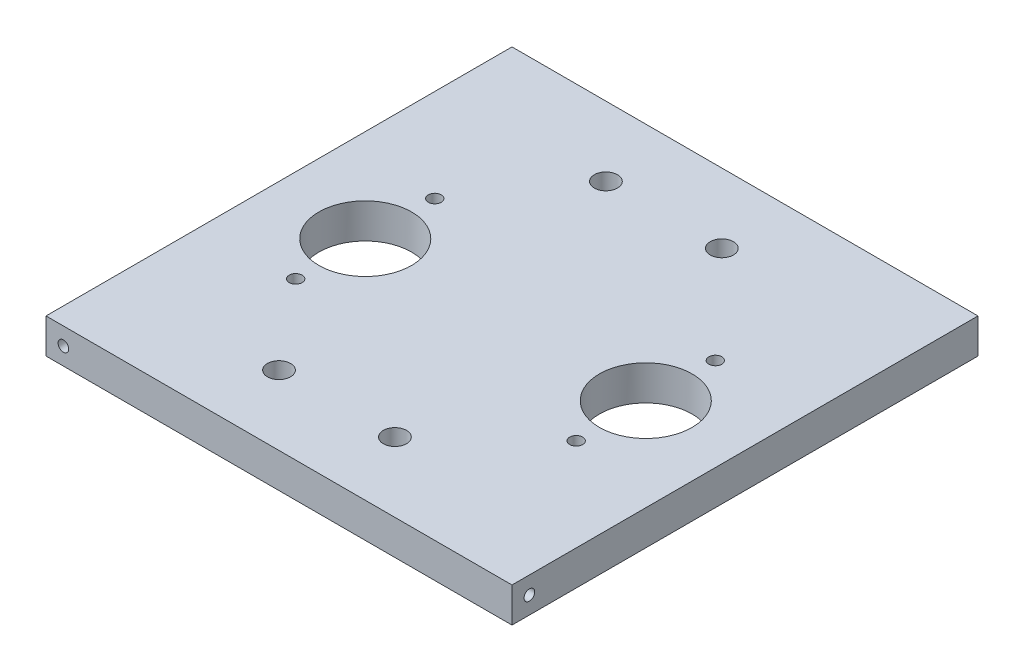
from build123d import *

# Parameters (mm, degrees)
SKETCH1_W                      = 127.635
SKETCH1_H                      = 127.635
MAIN_PLATE_DEPTH               = 9.525
SKETCH2_R                      = 3.175
U_BOLT_HOLE_DEPTH              = 12.7
U_BOLT_PATTERN_COUNT           = 2
U_BOLT_PATTERN_PITCH           = 31.75
U_BOLT_PATTERN_COUNT_DIR2      = 2
U_BOLT_PATTERN_PITCH_DIR2      = 89.535
SKETCH3_R                      = 1.778
RAPTOR_BOLT_HOLE_DEPTH         = 12.7
RAPTOR_BOLT_PATTERN_COUNT      = 2
RAPTOR_BOLT_PATTERN_PITCH      = 38.1
RAPTOR_BOLT_PATTERN_COUNT_DIR2 = 2
RAPTOR_BOLT_PATTERN_PITCH_DIR2 = 76.835
SKETCH4_R                      = 12.7
CO2_CYLINDER_HOLE_DEPTH        = 12.7
CO2_PATTERN_COUNT              = 2
CO2_PATTERN_PITCH              = 76.835
SKETCH5_R                      = 1.4605
FRAME_ATTACHMENT_HOLE_1_DEPTH  = 12.7
SKETCH6_R                      = 1.4605
FRAME_ATTACHMENT_HOLE_2_DEPTH  = 12.7
SKETCH7_R                      = 1.4605
FRAME_ATTACHMENT_HOLE_3_DEPTH  = 12.7
SKETCH8_R                      = 1.4605
FRAME_ATTACHMENT_HOLE_4_DEPTH  = 12.7


with BuildPart() as part:
    # Sketch1 → Main Plate (new body)
    with BuildSketch(Plane(origin=(0, 0, 0), x_dir=(1, 0, 0), z_dir=(0, 1, 0))):
        with Locations((63.8175, 63.8175)):
            Rectangle(SKETCH1_W, SKETCH1_H)
    extrude(amount=MAIN_PLATE_DEPTH)

    # Sketch2 → U-Bolt Hole (cut)
    with BuildSketch(Plane(origin=(0, 9.525, 0), x_dir=(1, 0, 0), z_dir=(0, 1, 0))):
        with Locations((44.7675, 108.585)):
            Circle(SKETCH2_R)
    u_bolt_hole = extrude(amount=-U_BOLT_HOLE_DEPTH, mode=Mode.SUBTRACT)

    # U-Bolt Pattern: U-Bolt Hole 2 × 2
    with Locations(*[(i * U_BOLT_PATTERN_PITCH, 0, j * U_BOLT_PATTERN_PITCH_DIR2) for i in range(U_BOLT_PATTERN_COUNT) for j in range(U_BOLT_PATTERN_COUNT_DIR2) if (i, j) != (0, 0)]):
        add(u_bolt_hole, mode=Mode.SUBTRACT)

    # Sketch3 → Raptor Bolt Hole (cut)
    with BuildSketch(Plane(origin=(0, 9.525, 0), x_dir=(1, 0, 0), z_dir=(0, 1, 0))):
        with Locations((25.4, 42.9895)):
            Circle(SKETCH3_R)
    raptor_bolt_hole = extrude(amount=-RAPTOR_BOLT_HOLE_DEPTH, mode=Mode.SUBTRACT)

    # Raptor Bolt Pattern: Raptor Bolt Hole 2 × 2
    with Locations(*[(j * RAPTOR_BOLT_PATTERN_PITCH_DIR2, 0, -i * RAPTOR_BOLT_PATTERN_PITCH) for i in range(RAPTOR_BOLT_PATTERN_COUNT) for j in range(RAPTOR_BOLT_PATTERN_COUNT_DIR2) if (i, j) != (0, 0)]):
        add(raptor_bolt_hole, mode=Mode.SUBTRACT)

    # Sketch4 → Co2 Cylinder Hole (cut)
    with BuildSketch(Plane(origin=(0, 9.525, 0), x_dir=(1, 0, 0), z_dir=(0, 1, 0))):
        with Locations((25.4, 62.0395)):
            Circle(SKETCH4_R)
    co2_cylinder_hole = extrude(amount=-CO2_CYLINDER_HOLE_DEPTH, mode=Mode.SUBTRACT)

    # Co2 Pattern: Co2 Cylinder Hole ×2
    with Locations(*[(i * CO2_PATTERN_PITCH, 0, 0) for i in range(1, CO2_PATTERN_COUNT)]):
        add(co2_cylinder_hole, mode=Mode.SUBTRACT)

    # Sketch5 → Frame attachment hole 1 (cut)
    with BuildSketch(Plane.XY):
        with Locations((4.7625, 4.7625)):
            Circle(SKETCH5_R)
    extrude(amount=-FRAME_ATTACHMENT_HOLE_1_DEPTH, mode=Mode.SUBTRACT)

    # Sketch6 → Frame attachment hole 2 (cut)
    with BuildSketch(Plane.ZY):
        with Locations((-122.8725, 4.7625)):
            Circle(SKETCH6_R)
    extrude(amount=-FRAME_ATTACHMENT_HOLE_2_DEPTH, mode=Mode.SUBTRACT)

    # Sketch7 → Frame attachment hole 3 (cut)
    with BuildSketch(Plane(origin=(0, 0, -127.635), x_dir=(-1, 0, 0), z_dir=(0, 0, -1))):
        with Locations((-122.8725, 4.7625)):
            Circle(SKETCH7_R)
    extrude(amount=-FRAME_ATTACHMENT_HOLE_3_DEPTH, mode=Mode.SUBTRACT)

    # Sketch8 → Frame attachment hole 4 (cut)
    with BuildSketch(Plane(origin=(127.635, 0, 0), x_dir=(0, 0, -1), z_dir=(1, 0, 0))):
        with Locations((4.7625, 4.7625)):
            Circle(SKETCH8_R)
    extrude(amount=-FRAME_ATTACHMENT_HOLE_4_DEPTH, mode=Mode.SUBTRACT)


solid = part.part
